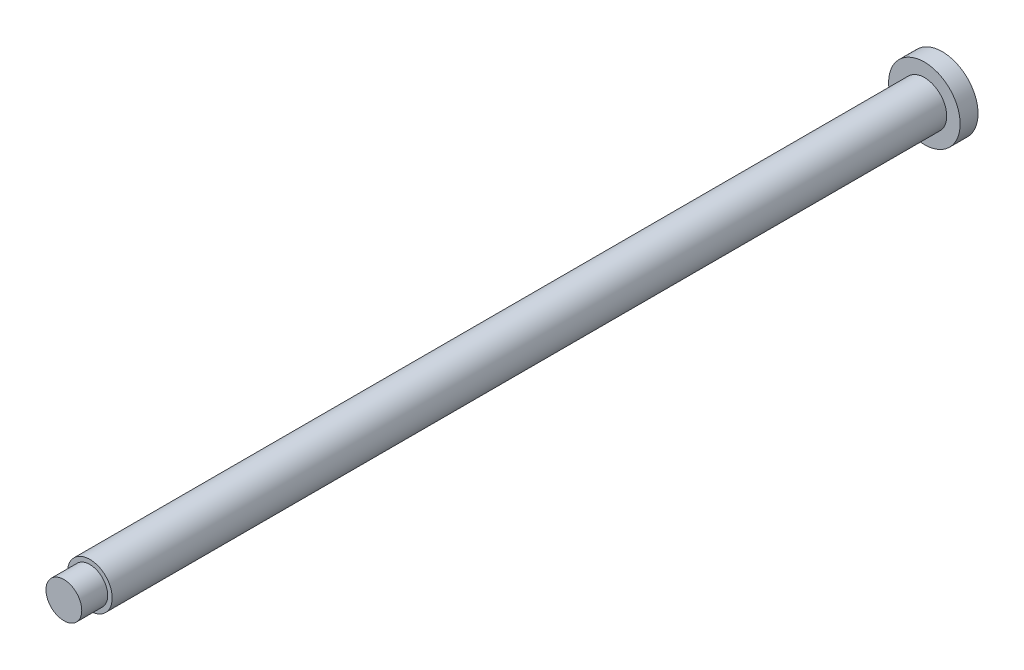
from build123d import *

# Parameters (mm, degrees)
SKETCH1_R           = 2.5
BOSS_EXTRUDE1_DEPTH = 93.25
SKETCH2_R           = 4
BOSS_EXTRUDE2_DEPTH = 2
SKETCH3_R           = 2.05
CUT_EXTRUDE1_DEPTH  = 3
SKETCH4_R           = 2
BOSS_EXTRUDE3_DEPTH = 2.9


with BuildPart() as part:
    # Sketch1 → Boss-Extrude1 (new body)
    with BuildSketch(Plane(origin=(0, 0, 0), x_dir=(0, 1, 0), z_dir=(0, 0, 1))):
        Circle(SKETCH1_R)
    extrude(amount=BOSS_EXTRUDE1_DEPTH)

    # Sketch2 → Boss-Extrude2 (add)
    with BuildSketch(Plane(origin=(0, 0, 0), x_dir=(1, 0, 0), z_dir=(0, 0, -1))):
        Circle(SKETCH2_R)
    extrude(amount=BOSS_EXTRUDE2_DEPTH)

    # Sketch3 → Cut-Extrude1 (cut)
    with BuildSketch(Plane(origin=(0, 0, -2), x_dir=(1, 0, 0), z_dir=(0, 0, -1))):
        Circle(SKETCH3_R)
    extrude(amount=-CUT_EXTRUDE1_DEPTH, mode=Mode.SUBTRACT)

    # Sketch4 → Boss-Extrude3 (add)
    with BuildSketch(Plane.XY.offset(93.25)):
        Circle(SKETCH4_R)
    extrude(amount=BOSS_EXTRUDE3_DEPTH)


solid = part.part
